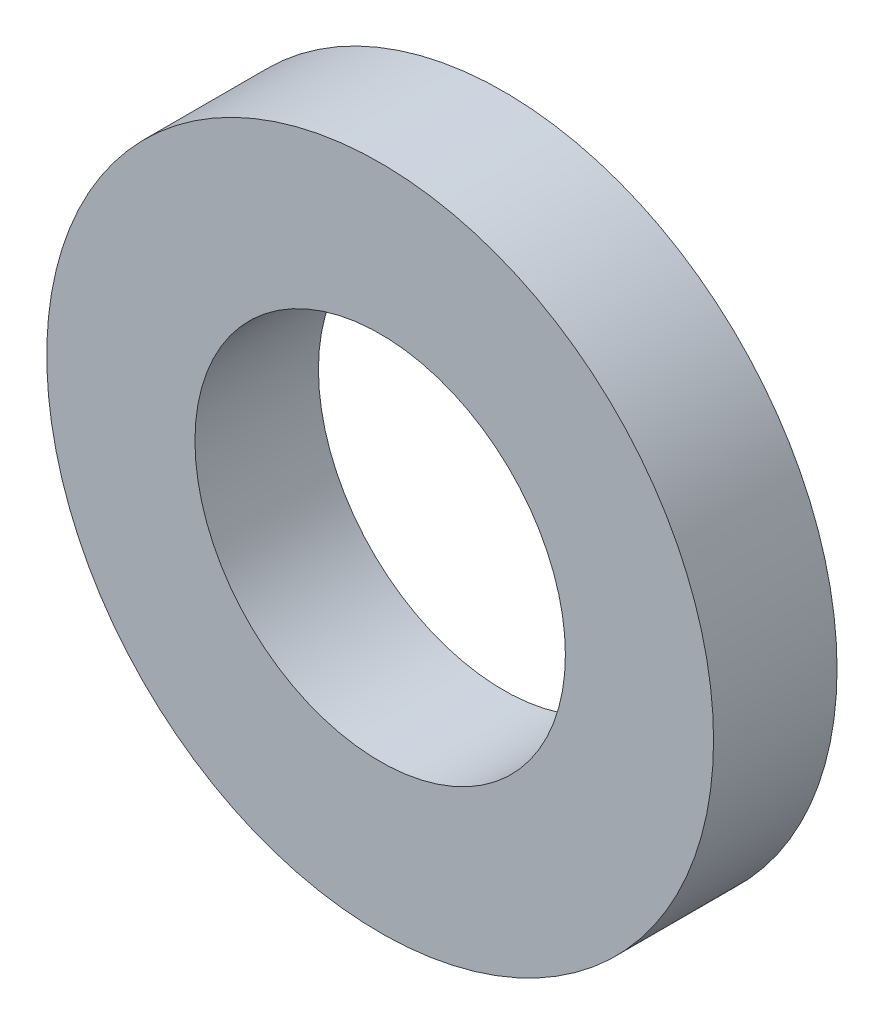
from build123d import *

# Parameters (mm, degrees)
SKETCH1_R           = 13.5
SKETCH1_R_2         = 7.5
BOSS_EXTRUDE1_DEPTH = 5


with BuildPart() as part:
    # Sketch1 → Boss-Extrude1 (new body)
    with BuildSketch(Plane.XY):
        Circle(SKETCH1_R)
        Circle(SKETCH1_R_2, mode=Mode.SUBTRACT)
    extrude(amount=BOSS_EXTRUDE1_DEPTH)


solid = part.part
